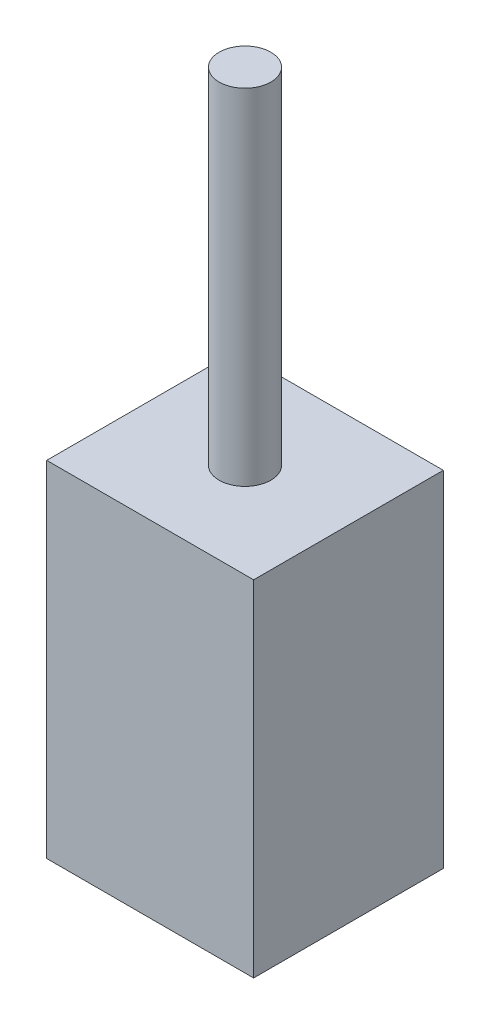
from build123d import *

# Parameters (mm, degrees)
SKETCH1_W           = 12
SKETCH1_H           = 11
BOSS_EXTRUDE1_DEPTH = 20
SKETCH2_R           = 1.5
BOSS_EXTRUDE2_DEPTH = 20


with BuildPart() as part:
    # Sketch1 → Boss-Extrude1 (new body)
    with BuildSketch(Plane(origin=(0, 0, 0), x_dir=(1, 0, 0), z_dir=(0, 1, 0))):
        with Locations((6, 5.5)):
            Rectangle(SKETCH1_W, SKETCH1_H)
    extrude(amount=BOSS_EXTRUDE1_DEPTH)

    # Sketch2 → Boss-Extrude2 (add)
    with BuildSketch(Plane(origin=(0, 20, 0), x_dir=(1, 0, 0), z_dir=(0, 1, 0))):
        with Locations((6, 5.5)):
            Circle(SKETCH2_R)
    extrude(amount=BOSS_EXTRUDE2_DEPTH)


solid = part.part
